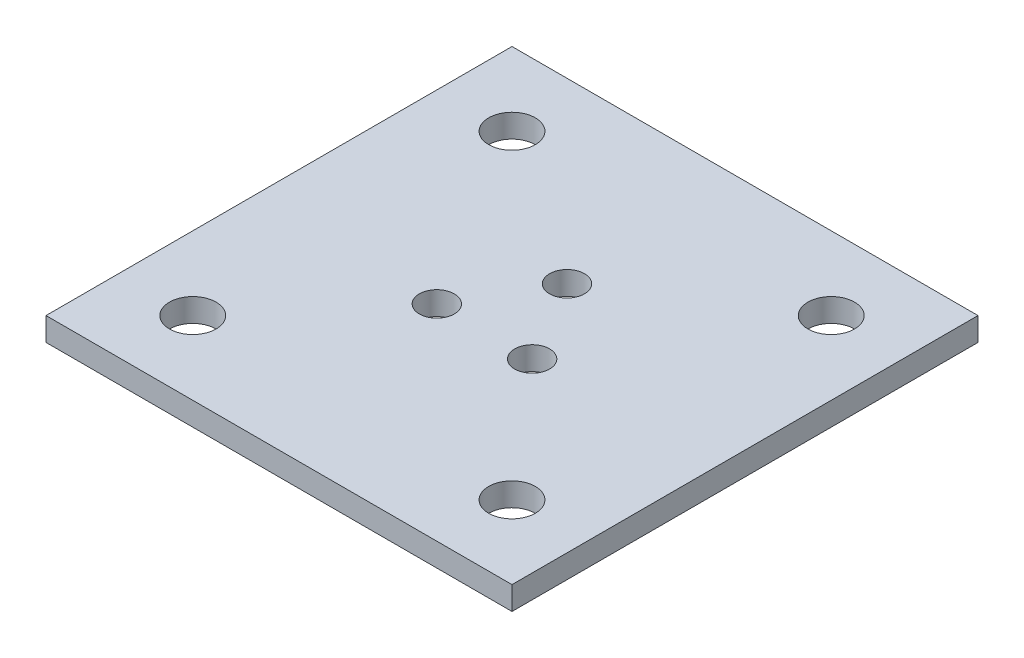
from build123d import *

# Parameters (mm, degrees)
SKETCH1_W           = 63.5
SKETCH1_H           = 63.5
BOSS_EXTRUDE1_DEPTH = 3.175
SKETCH2_R           = 2.38125
CUT_EXTRUDE1_DEPTH  = 46.01339384
SKETCH3_R           = 3.175
CUT_EXTRUDE2_DEPTH  = 46.01339384


with BuildPart() as part:
    # Sketch1 → Boss-Extrude1 (new body)
    with BuildSketch(Plane(origin=(0, 0, 0), x_dir=(1, 0, 0), z_dir=(0, 1, 0))):
        Rectangle(SKETCH1_W, SKETCH1_H)
    extrude(amount=BOSS_EXTRUDE1_DEPTH)

    # Sketch2 → Cut-Extrude1 (cut, through all)
    with BuildSketch(Plane(origin=(0, 3.175, 0), x_dir=(1, 0, 0), z_dir=(0, 1, 0))):
        with Locations((0, 7.5)):
            Circle(SKETCH2_R)
        with Locations((6.495190528, -3.75)):
            Circle(SKETCH2_R)
        with Locations((-6.495190528, -3.75)):
            Circle(SKETCH2_R)
    extrude(amount=-CUT_EXTRUDE1_DEPTH, mode=Mode.SUBTRACT)

    # Sketch3 → Cut-Extrude2 (cut, through all)
    with BuildSketch(Plane(origin=(0, 3.175, 0), x_dir=(1, 0, 0), z_dir=(0, 1, 0))):
        with Locations((-21.75, 21.75)):
            Circle(SKETCH3_R)
        with Locations((21.75, 21.75)):
            Circle(SKETCH3_R)
        with Locations((21.75, -21.75)):
            Circle(SKETCH3_R)
        with Locations((-21.75, -21.75)):
            Circle(SKETCH3_R)
    extrude(amount=-CUT_EXTRUDE2_DEPTH, mode=Mode.SUBTRACT)


solid = part.part
